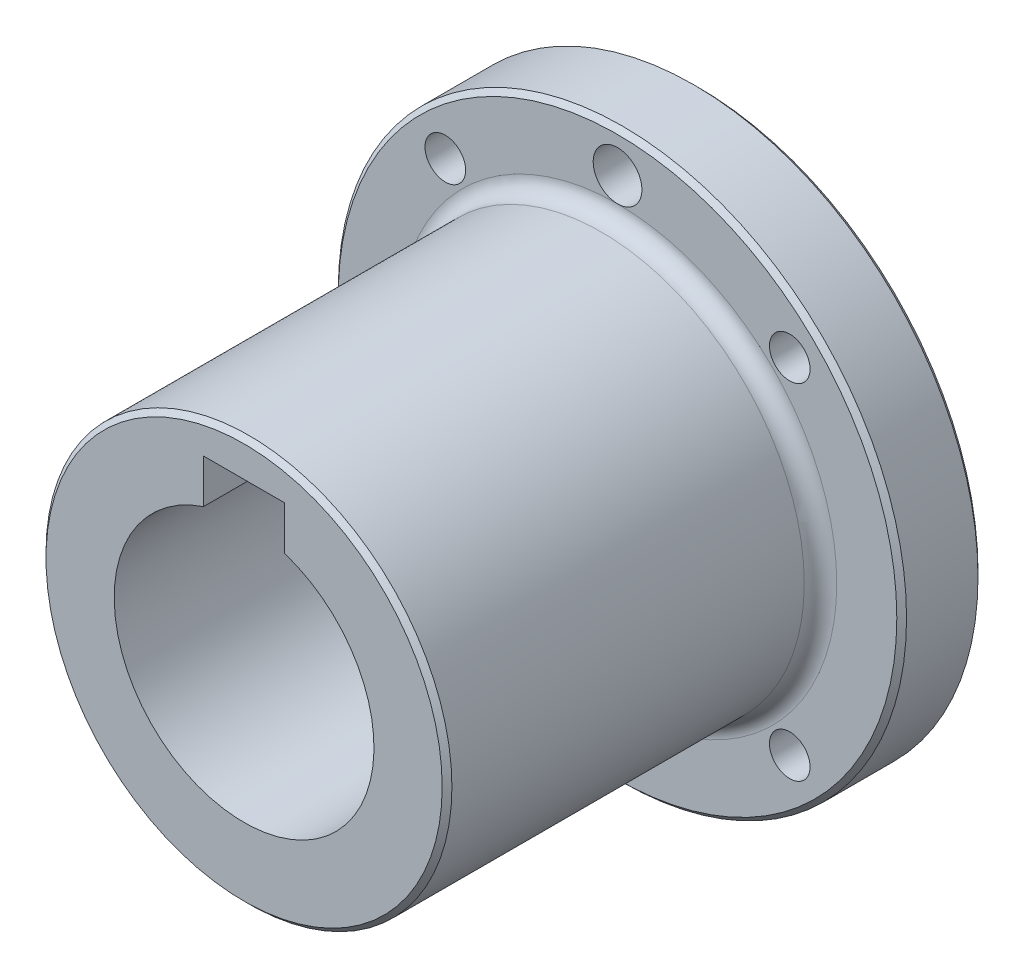
from build123d import *

# Parameters (mm, degrees)
SKETCH1_R             = 17.5
BOSS_EXTRUDE1_DEPTH   = 5
F_3_0MM_DOWEL_HOLE1_D = 3
M3X0_5_TAPPED_HOLE1_D = 2.5
SKETCH10_R            = 12.5
BOSS_EXTRUDE2_DEPTH   = 23
CHAMFER1_SIZE         = 0.3
KEYWAY_DEPTH          = 39.539297239
FILLET1_R             = 1


with BuildPart() as part:
    # Sketch1 → Boss-Extrude1 (new body)
    with BuildSketch(Plane.XY):
        with Locations((100, 0)):
            Circle(SKETCH1_R)
    extrude(amount=BOSS_EXTRUDE1_DEPTH)

    # Ø3.0mm Dowel Hole1 (through all)
    with Locations(Plane(origin=(0, 0, 0), x_dir=(-1, 0, 0), z_dir=(0, 0, -1))):
        with Locations((-100, 15)):
            Hole(F_3_0MM_DOWEL_HOLE1_D / 2)

    # M3x0.5 Tapped Hole1 (through all)
    with Locations(Plane(origin=(0, 0, 0), x_dir=(-1, 0, 0), z_dir=(0, 0, -1))):
        with Locations((-110.606601718, 10.606601718), (-89.393398282, 10.606601718), (-110.606601718, -10.606601718), (-89.393398282, -10.606601718)):
            Hole(M3X0_5_TAPPED_HOLE1_D / 2)

    # Sketch10 → Boss-Extrude2 (add)
    with BuildSketch(Plane.XY.offset(5)):
        with Locations((100, 0)):
            Circle(SKETCH10_R)
    extrude(amount=BOSS_EXTRUDE2_DEPTH)

    # Chamfer1
    chamfer1_edges = [part.edges().sort_by_distance(p)[0] for p in [
        (88.143398282, -10.606601718, 0),
        (82.5, 0, 0),
        (109.356601718, -10.606601718, 0),
        (88.143398282, 10.606601718, 0),
        (109.356601718, 10.606601718, 0),
        (87.5, 0, 28),
        (82.5, 0, 5),
        (98.5, 15, 0),
    ]]
    chamfer(chamfer1_edges, length=CHAMFER1_SIZE)

    # KeySketch → Keyway (cut, through all)
    with BuildSketch(Plane(origin=(101.36896109, 1.08062806, 28), x_dir=(1, 0, 0), z_dir=(0, 0, 1))):
        with BuildLine():
            Line((-3.86896109, 6.518714017), (-3.86896109, 9.21937194))
            Line((-3.86896109, 9.21937194), (1.13103891, 9.21937194))
            Line((1.13103891, 9.21937194), (1.13103891, 6.518714017))
            ThreePointArc((1.13103891, 6.518714017), (-1.36896109, -9.08062806), (-3.86896109, 6.518714017))
        make_face()
    extrude(amount=-KEYWAY_DEPTH, mode=Mode.SUBTRACT)

    # Fillet1
    fillet1_edges = [part.edges().sort_by_distance(p)[0] for p in [
        (87.5, 0, 5),
    ]]
    fillet(fillet1_edges, radius=FILLET1_R - 0.0001)  # a hair under: the kernel refuses the full size


solid = part.part
